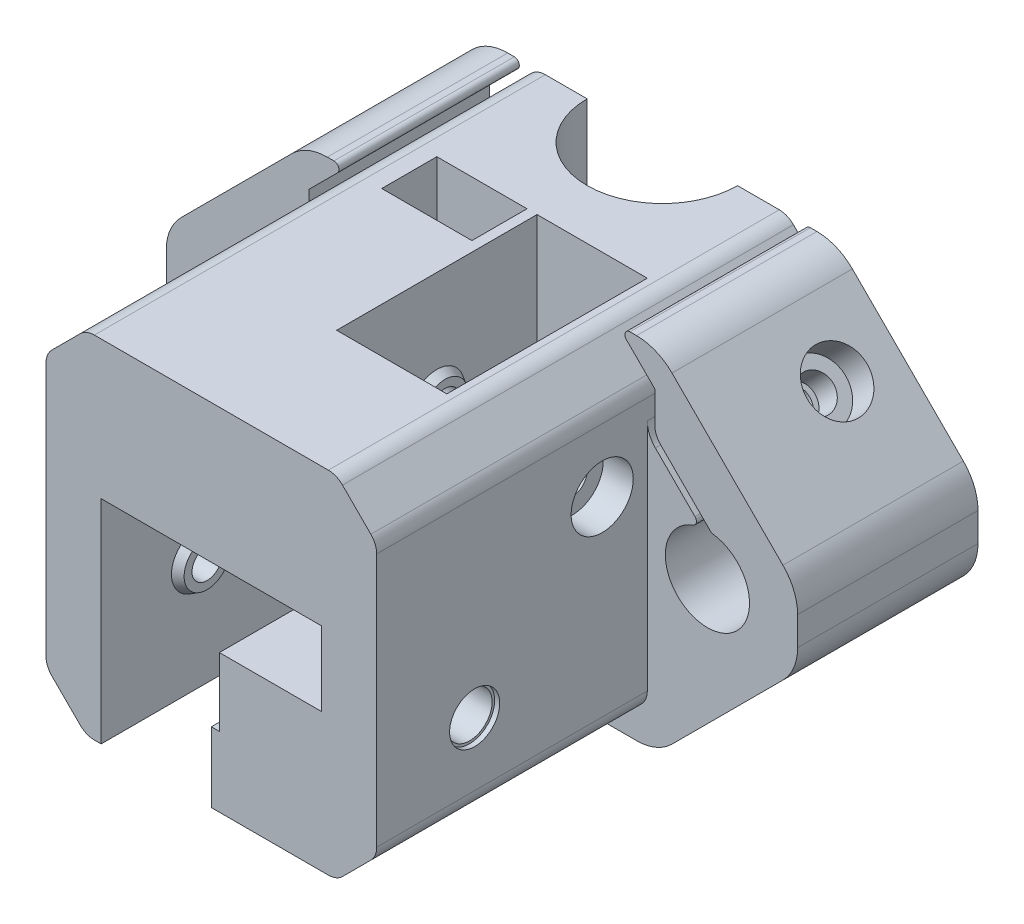
from build123d import *

# Parameters (mm, degrees)
BOSS_EXTRUDE1_DEPTH     = 18
SKETCH2_R               = 7.5
SKETCH2_W               = 9
SKETCH2_H               = 5.5
CUT_EXTRUDE1_DEPTH      = 51.410812332
FILLET1_R               = 5
FILLET2_R               = 0.5
FILLET3_R               = 2
FILLET4_R               = 2.75
CUT_EXTRUDE2_DEPTH      = 15
SKETCH7_R               = 1.6
CUT_EXTRUDE3_DEPTH      = 10
SKETCH8_R               = 2.35
CUT_EXTRUDE4_DEPTH      = 5
SKETCH9_R               = 2.5
CUT_EXTRUDE5_DEPTH      = 0.5
MIRROR3_COPY_1_SKETCH_R = 1.6
MIRROR3_COPY_1_DEPTH    = 10
MIRROR3_COPY_2_SKETCH_R = 2.35
MIRROR3_COPY_2_DEPTH    = 5
MIRROR3_COPY_3_SKETCH_R = 2.5
MIRROR3_COPY_3_DEPTH    = 0.5
BOSS_EXTRUDE2_DEPTH     = 27
SKETCH11_W              = 11
SKETCH11_H              = 20
CUT_EXTRUDE6_DEPTH      = 21.2
SKETCH12_W              = 11
SKETCH12_H              = 3.7
CUT_EXTRUDE7_DEPTH      = 12.5
FILLET5_R               = 10
CUT_EXTRUDE8_REACH      = 67.133
SKETCH13_W              = 11
SKETCH13_H              = 19.8
FILLET6_R               = 10
SKETCH14_W              = 11
SKETCH14_H              = 7.4
CUT_EXTRUDE9_DEPTH      = 12.5
SKETCH15_R              = 2.75
BOSS_EXTRUDE3_DEPTH     = 0.8
BOSS_EXTRUDE3_TAPER     = 30
SKETCH16_W              = 14
SKETCH16_H              = 6.815
CUT_EXTRUDE10_DEPTH     = 0.8
SKETCH19_R              = 2.75
BOSS_EXTRUDE4_DEPTH     = 0.8
BOSS_EXTRUDE4_TAPER     = 30
FILLET7_R               = 2


with BuildPart() as part:
    # Sketch1 → Boss-Extrude1 (new body)
    with BuildSketch(Plane.XY):
        with BuildLine():
            Line((-17.5, 17.5), (-31.5, 3.5))
            Line((-31.5, 3.5), (-31.5, -3.5))
            Line((-31.5, -3.5), (-17.5, -17.5))
            Line((-17.5, -17.5), (17.5, -17.5))
            Line((17.5, -17.5), (31.5, -3.5))
            Line((31.5, -3.5), (31.5, 3.5))
            Line((31.5, 3.5), (17.5, 17.5))
            Line((17.5, 17.5), (13.560660172, 17.5))
            Line((13.560660172, 17.5), (17.25, 13.810660172))
            Line((17.25, 13.810660172), (17.25, 9.845660172))
            Line((17.25, 9.845660172), (22.916347453, 4.179312718))
            ThreePointArc((22.916347453, 4.179312718), (22.602164744, -4.198757241), (21.880882362, 4.154117638))
            Line((21.880882362, 4.154117638), (16.5, 9.535))
            Line((16.5, 9.535), (16.5, 13.5))
            Line((16.5, 13.5), (12.5, 17.5))
            Line((12.5, 17.5), (-12.5, 17.5))
            Line((-12.5, 17.5), (-16.5, 13.5))
            Line((-16.5, 13.5), (-16.5, 9.535))
            Line((-16.5, 9.535), (-21.880882362, 4.154117638))
            ThreePointArc((-21.880882362, 4.154117638), (-22.602164744, -4.198757241), (-22.916347453, 4.179312718))
            Line((-22.916347453, 4.179312718), (-17.25, 9.845660172))
            Line((-17.25, 9.845660172), (-17.25, 13.810660172))
            Line((-17.25, 13.810660172), (-13.560660172, 17.5))
            Line((-13.560660172, 17.5), (-17.5, 17.5))
        make_face()
    extrude(amount=BOSS_EXTRUDE1_DEPTH)

    # Sketch2 → Cut-Extrude1 (cut, through all)
    with BuildSketch(Plane(origin=(0, 17.5, 0), x_dir=(1, 0, 0), z_dir=(0, 1, 0))):
        Circle(SKETCH2_R)
        with Locations((-5.5, -15.25)):
            Rectangle(SKETCH2_W, SKETCH2_H)
    extrude(amount=-CUT_EXTRUDE1_DEPTH, mode=Mode.SUBTRACT)

    # Fillet1
    fillet1_edges = [part.edges().sort_by_distance(p)[0] for p in [
        (17.5, 17.5, 9),
        (31.5, 3.5, 9),
        (31.5, -3.5, 9),
        (17.5, -17.5, 9),
        (-17.5, -17.5, 9),
        (-31.5, -3.5, 9),
        (-31.5, 3.5, 9),
        (-17.5, 17.5, 9),
    ]]
    fillet(fillet1_edges, radius=FILLET1_R)

    # Fillet2
    fillet2_edges = [part.edges().sort_by_distance(p)[0] for p in [
        (-13.560660172, 17.5, 9),
        (-22.916347453, 4.179312718, 9),
        (-21.880882362, 4.154117638, 9),
        (21.880882362, 4.154117638, 9),
        (22.916347453, 4.179312718, 9),
        (13.560660172, 17.5, 9),
    ]]
    fillet(fillet2_edges, radius=FILLET2_R)

    # Fillet3
    fillet3_edges = [part.edges().sort_by_distance(p)[0] for p in [
        (-17.25, 9.845660172, 9),
        (17.25, 9.845660172, 9),
    ]]
    fillet(fillet3_edges, radius=FILLET3_R)

    # Fillet4
    fillet4_edges = [part.edges().sort_by_distance(p)[0] for p in [
        (-16.5, 9.535, 9),
        (16.5, 9.535, 9),
    ]]
    fillet(fillet4_edges, radius=FILLET4_R)

    # Sketch4 → Cut-Revolve1 (revolve, cut)
    with BuildSketch(Plane(origin=(0, 0, 6), x_dir=(-1, 0, 0), z_dir=(0, 0, -1))):
        Polygon((23.439696962, 11.560303038), (25.561017306, 9.438982694), (23.439696962, 7.317662351), (22.555813485, 8.201545827), (14.070532111, -0.283735547), (12.833095244, 0.95370132), align=None)
    cut_revolve1 = revolve(axis=Axis((-23.439696962, 11.560303038, 6), (0.7071067811865471, -0.707106781186548, 0)), mode=Mode.SUBTRACT)

    # Sketch6 → Cut-Extrude2 (cut)
    with BuildSketch(Plane(origin=(-6.893398282, 6.893398282, 0), x_dir=(0, 0, 1), z_dir=(-0.7071067811865471, 0.707106781186548, 0))):
        Polygon((3.425, -9.886676943), (6, -11.373353886), (8.575, -9.886676943), (8.575, -6.913323057), (6, -5.426646114), (3.425, -6.913323057), align=None)
    cut_extrude2 = extrude(amount=-CUT_EXTRUDE2_DEPTH, mode=Mode.SUBTRACT)

    # Mirror1: Cut-Revolve1, Cut-Extrude2 across plane
    add(cut_revolve1.mirror(Plane(origin=(0, 0, 0), x_dir=(0, 0, 1), z_dir=(1, 0, 0))), mode=Mode.SUBTRACT)
    add(cut_extrude2.mirror(Plane(origin=(0, 0, 0), x_dir=(0, 0, 1), z_dir=(1, 0, 0))), mode=Mode.SUBTRACT)

    # Sketch7 → Cut-Extrude3 (cut)
    with BuildSketch(Plane(origin=(0, 0, 0), x_dir=(-1, 0, 0), z_dir=(0, 0, -1))):
        with Locations((-12.5, 12.5)):
            Circle(SKETCH7_R)
    cut_extrude3 = extrude(amount=-CUT_EXTRUDE3_DEPTH, mode=Mode.SUBTRACT)

    # Sketch8 → Cut-Extrude4 (cut)
    with BuildSketch(Plane(origin=(0, 0, 0), x_dir=(-1, 0, 0), z_dir=(0, 0, -1))):
        with Locations((-12.5, 12.5)):
            Circle(SKETCH8_R)
    cut_extrude4 = extrude(amount=-CUT_EXTRUDE4_DEPTH, mode=Mode.SUBTRACT)

    # Sketch9 → Cut-Extrude5 (cut)
    with BuildSketch(Plane(origin=(0, 0, 0), x_dir=(-1, 0, 0), z_dir=(0, 0, -1))):
        with Locations((-12.5, 12.5)):
            Circle(SKETCH9_R)
    cut_extrude5 = extrude(amount=-CUT_EXTRUDE5_DEPTH, mode=Mode.SUBTRACT)

    # Mirror2: Cut-Extrude3, Cut-Extrude4, Cut-Extrude5 across plane
    add(cut_extrude3.mirror(Plane.ZX), mode=Mode.SUBTRACT)
    add(cut_extrude4.mirror(Plane.ZX), mode=Mode.SUBTRACT)
    add(cut_extrude5.mirror(Plane.ZX), mode=Mode.SUBTRACT)

    # Mirror3: Cut-Extrude3, Cut-Extrude4, Cut-Extrude5 across plane
    add(cut_extrude3.mirror(Plane(origin=(0, 0, 0), x_dir=(0, 0, 1), z_dir=(1, 0, 0))), mode=Mode.SUBTRACT)
    add(cut_extrude4.mirror(Plane(origin=(0, 0, 0), x_dir=(0, 0, 1), z_dir=(1, 0, 0))), mode=Mode.SUBTRACT)
    add(cut_extrude5.mirror(Plane(origin=(0, 0, 0), x_dir=(0, 0, 1), z_dir=(1, 0, 0))), mode=Mode.SUBTRACT)

    # Mirror3 copy 1 sketch → Mirror3 copy 1 (cut)
    with BuildSketch(Plane(origin=(0, 0, 0), x_dir=(1, 0, 0), z_dir=(0, 0, -1))):
        with Locations((-12.5, 12.5)):
            Circle(MIRROR3_COPY_1_SKETCH_R)
    extrude(amount=-MIRROR3_COPY_1_DEPTH, mode=Mode.SUBTRACT)

    # Mirror3 copy 2 sketch → Mirror3 copy 2 (cut)
    with BuildSketch(Plane(origin=(0, 0, 0), x_dir=(1, 0, 0), z_dir=(0, 0, -1))):
        with Locations((-12.5, 12.5)):
            Circle(MIRROR3_COPY_2_SKETCH_R)
    extrude(amount=-MIRROR3_COPY_2_DEPTH, mode=Mode.SUBTRACT)

    # Mirror3 copy 3 sketch → Mirror3 copy 3 (cut)
    with BuildSketch(Plane(origin=(0, 0, 0), x_dir=(1, 0, 0), z_dir=(0, 0, -1))):
        with Locations((-12.5, 12.5)):
            Circle(MIRROR3_COPY_3_SKETCH_R)
    extrude(amount=-MIRROR3_COPY_3_DEPTH, mode=Mode.SUBTRACT)

    # Sketch10 → Boss-Extrude2 (add)
    with BuildSketch(Plane.XY.offset(18)):
        Polygon((12.5, 17.5), (-12.5, 17.5), (-16.5, 13.5), (-16.5, -13.5), (-12.5, -17.5), (12.5, -17.5), (16.5, -13.5), (16.5, 13.5), align=None)
    extrude(amount=BOSS_EXTRUDE2_DEPTH)

    # Sketch11 → Cut-Extrude6 (cut)
    with BuildSketch(Plane(origin=(0, 17.5, 0), x_dir=(1, 0, 0), z_dir=(0, 1, 0))):
        with Locations((5.5, -22.5)):
            Rectangle(SKETCH11_W, SKETCH11_H)
    extrude(amount=-CUT_EXTRUDE6_DEPTH, mode=Mode.SUBTRACT)

    # Sketch12 → Cut-Extrude7 (cut)
    with BuildSketch(Plane(origin=(0, 0, 32.5), x_dir=(-1, 0, 0), z_dir=(0, 0, -1))):
        with Locations((-5.5, 1.85)):
            Rectangle(SKETCH12_W, SKETCH12_H)
        Polygon((-11, -3.7), (0, -3.7), (0, -3.591245546), (0, 0), (-11, 0), align=None)
    extrude(amount=-CUT_EXTRUDE7_DEPTH, mode=Mode.SUBTRACT)

    # Fillet5
    fillet5_edges = [part.edges().sort_by_distance(p)[0] for p in [
        (5.5, -3.7, 12.5),
    ]]
    fillet(fillet5_edges, radius=FILLET5_R)

    # Cut-Extrude8: up to this face of the body (flat: up to its plane)
    cut_extrude8_end = Plane(part.part.faces().sort_by_distance((5.5, 3.7, 38.75))[0])
    # Sketch13 → Cut-Extrude8 (cut, up to the picked face)
    with BuildSketch(Plane.XZ.offset(17.5), mode=Mode.PRIVATE) as cut_extrude8_sk1:
        with Locations((-5.5, 35.1)):
            Rectangle(SKETCH13_W, SKETCH13_H)
    cut_extrude8_tool1 = split(extrude(cut_extrude8_sk1.sketch, amount=-CUT_EXTRUDE8_REACH, mode=Mode.PRIVATE), bisect_by=cut_extrude8_end, keep=Keep.BOTH, mode=Mode.PRIVATE)
    add(cut_extrude8_tool1.solids().sort_by(Axis((-5.5, -17.5, 35.1), (0, 1, 0)))[0], mode=Mode.SUBTRACT)

    # Fillet6
    # the kernel refuses this fillet: 10 mm, written as the material it adds along each edge
    with BuildSketch(Plane(origin=(25, 3.7, 25.2), x_dir=(0, 0, 1), z_dir=(-1, 0, 0))) as fillet6_piece_1_section:
        with BuildLine():
            CenterArc((FILLET6_R, -FILLET6_R), FILLET6_R, 90, 90)
            Line((0, -FILLET6_R), (0, 0))
            Line((0, 0), (FILLET6_R, 0))
        make_face()
    fillet6_piece_1 = extrude(amount=36, mode=Mode.PRIVATE)
    fillet6_piece_1 = split(fillet6_piece_1, bisect_by=Plane(origin=(5.5, 3.588944861, 32.5), z_dir=(0, 0, 1)), keep=Keep.TOP, mode=Mode.PRIVATE)
    fillet6_piece_1 = split(fillet6_piece_1, bisect_by=Plane(origin=(11, 3.588944861, 33.172467691), z_dir=(-1, 0, 0)), keep=Keep.TOP, mode=Mode.PRIVATE)
    add(fillet6_piece_1)
    with BuildSketch(Plane(origin=(0, 3.7, 25.2), x_dir=(0, 0, 1), z_dir=(-1, 0, 0))) as fillet6_piece_2:
        with BuildLine():
            CenterArc((FILLET6_R, -FILLET6_R), FILLET6_R, 90, 90)
            Line((0, -FILLET6_R), (0, 0))
            Line((0, 0), (FILLET6_R, 0))
        make_face()
    extrude(amount=11)

    # Sketch14 → Cut-Extrude9 (cut)
    with BuildSketch(Plane.XY.offset(45)):
        with Locations((5.5, 0)):
            Rectangle(SKETCH14_W, SKETCH14_H)
    extrude(amount=-CUT_EXTRUDE9_DEPTH, mode=Mode.SUBTRACT)

    # Sketch15 → Boss-Extrude3 (add)
    with BuildSketch(Plane(origin=(-11, 0, 0), x_dir=(0, 0, -1), z_dir=(1, 0, 0))):
        with Locations((-35.23, -6.365)):
            Circle(SKETCH15_R)
    extrude(amount=BOSS_EXTRUDE3_DEPTH, taper=BOSS_EXTRUDE3_TAPER)

    # Sketch16 → Cut-Extrude10 (cut)
    with BuildSketch(Plane.ZY):
        with Locations((38, -7.1075)):
            Rectangle(SKETCH16_W, SKETCH16_H)
    extrude(amount=-CUT_EXTRUDE10_DEPTH, mode=Mode.SUBTRACT)

    # Sketch17 → Cut-Revolve2 (revolve, cut)
    with BuildSketch(Plane.XY.offset(35.23)):
        Polygon((-16.5, -6.365), (-16.5, -3.265), (-13.5, -3.265), (-13.5, -4.865), (11.5, -4.865), (11.5, -4.115), (16, -4.115), (16, -3.865), (16.5, -3.865), (16.5, -6.365), align=None)
    revolve(axis=Axis((31.947720378, -6.365, 35.23), (-1, 0, 0)), mode=Mode.SUBTRACT)

    # Sketch19 → Boss-Extrude4 (add)
    with BuildSketch(Plane.ZY.offset(-11)):
        with Locations((22.5, 6.365)):
            Circle(SKETCH19_R)
    boss_extrude4 = extrude(amount=BOSS_EXTRUDE4_DEPTH, taper=BOSS_EXTRUDE4_TAPER)

    # Mirror4: Boss-Extrude4 across plane
    add(boss_extrude4.mirror(Plane(origin=(5.5, 0, 0), x_dir=(0, 0, 1), z_dir=(1, 0, 0))))

    # Sketch20 → Cut-Revolve3 (revolve, cut)
    with BuildSketch(Plane.XY.offset(22.5), mode=Mode.PRIVATE) as cut_revolve3_sk:
        Polygon((16.5, 6.365), (16.5, 9.465), (13.5, 9.465), (13.5, 7.865), (-11.5, 7.865), (-11.5, 8.615), (-16, 8.615), (-16, 8.865), (-16.5, 8.865), (-16.5, 6.365), align=None)
    revolve(cut_revolve3_sk.sketch.rotate(Axis((11, 6.365, 22.5), (-1, 0, 0)), 90), axis=Axis((11, 6.365, 22.5), (-1, 0, 0)), mode=Mode.SUBTRACT)

    # Fillet7
    fillet7_edges = [part.edges().sort_by_distance(p)[0] for p in [
        (16.5, -13.5, 31.5),
        (12.5, -17.5, 31.5),
        (-12.5, -17.5, 31.5),
        (-16.5, -13.5, 31.5),
        (-16.5, 13.5, 22.5),
        (-12.5, 17.5, 22.5),
        (12.5, 17.5, 22.5),
        (16.5, 13.5, 22.5),
    ]]
    fillet(fillet7_edges, radius=FILLET7_R)


solid = part.part
